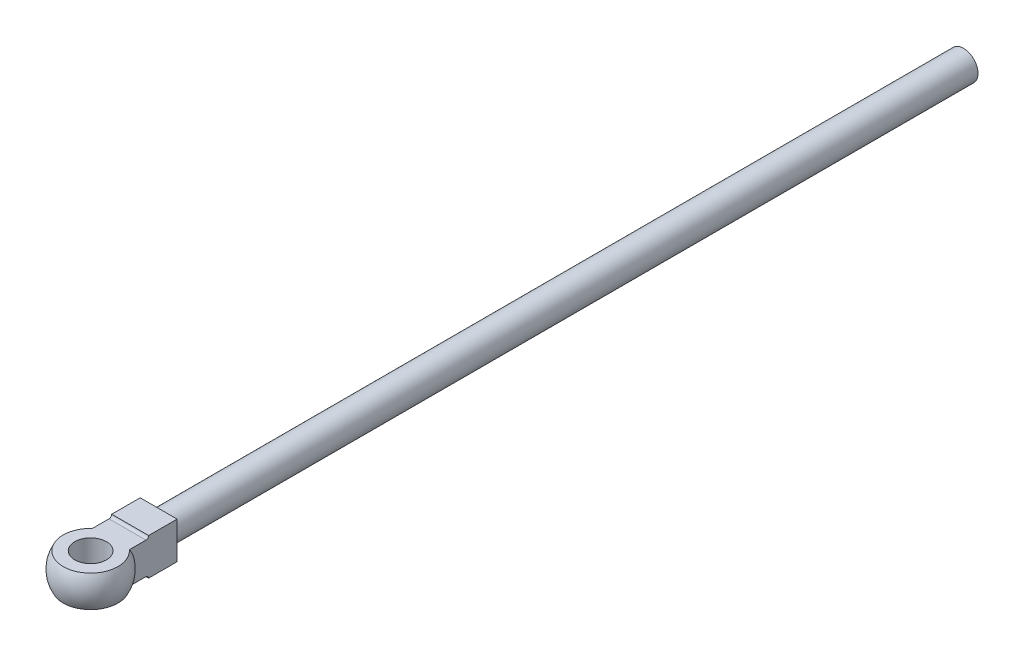
from build123d import *

# Parameters (mm, degrees)
SKETCH_5_W          = 70
SKETCH_5_H          = 70
EXTRUDE_2_DEPTH     = 130
SKETCH_11_R         = 27.5
EXTRUDE_4_DEPTH     = 1525
SKETCH_12_W         = 103.923048454
SKETCH_12_H         = 8.094806624
SKETCH_12_H_2       = 10.367731853
CUT_EXTRUDE_1_DEPTH = 75
CUT_EXTRUDE_START   = -75
SKETCH_13_R         = 30
CUT_EXTRUDE_2_DEPTH = 75
FILLET_3_R          = 5
FILLET_2_R          = 1
CHAMFER_2_SIZE      = 1


with BuildPart() as part:
    # 草图3 → 旋转1 (revolve)
    with BuildSketch(Plane.XY):
        with BuildLine():
            Line((-30, -30), (-30, 30))
            Line((-30, 30), (-51.961524227, 30))
            ThreePointArc((-51.961524227, 30), (-60, 0), (-51.961524227, -30))
            Line((-51.961524227, -30), (-30, -30))
        make_face()
    revolve(axis=Axis((0, 0, 0), (0, 1, 0)))

    # 草图5 → 凸台-拉伸2 (add)
    with BuildSketch(Plane.XY.offset(-130)):
        Rectangle(SKETCH_5_W, SKETCH_5_H)
    extrude(amount=EXTRUDE_2_DEPTH)

    # 草图11 → 凸台-拉伸4 (add)
    with BuildSketch(Plane(origin=(0, 0, -130), x_dir=(-1, 0, 0), z_dir=(0, 0, -1))):
        Circle(SKETCH_11_R)
    extrude(amount=EXTRUDE_4_DEPTH)

    # 草图12 → 切除-拉伸1 (cut)
    with BuildSketch(Plane.XY):
        with Locations((0, 34.047403312)):
            Rectangle(SKETCH_12_W, SKETCH_12_H)
        with Locations((0, -35.183865927)):
            Rectangle(SKETCH_12_W, SKETCH_12_H_2)
    extrude(amount=-CUT_EXTRUDE_1_DEPTH, mode=Mode.SUBTRACT)

    # 草图13 → 切除-拉伸2 (cut)
    with BuildSketch(Plane.XZ.offset(30).offset(CUT_EXTRUDE_START)):
        with Locations(Location((0, 0, 0), (0, 0, 270))):
            Circle(SKETCH_13_R)
    extrude(amount=CUT_EXTRUDE_2_DEPTH, mode=Mode.SUBTRACT)

    # 圆角3
    fillet_3_edges = [part.edges().sort_by_distance(p)[0] for p in [
        (0, -30, -75),
        (0, 30, -75),
    ]]
    fillet(fillet_3_edges, radius=FILLET_3_R - 0.0001)  # a hair under: the kernel refuses the full size

    # 圆角2
    fillet_2_edges = [part.edges().sort_by_distance(p)[0] for p in [
        (27.5, 0, -130),
    ]]
    fillet(fillet_2_edges, radius=FILLET_2_R)

    # 倒角2
    chamfer_2_edges = [part.edges().sort_by_distance(p)[0] for p in [
        (35, 0, -130),
        (-35, 0, -130),
        (0, 35, -130),
        (0, -35, -130),
    ]]
    chamfer(chamfer_2_edges, length=CHAMFER_2_SIZE)


solid = part.part
